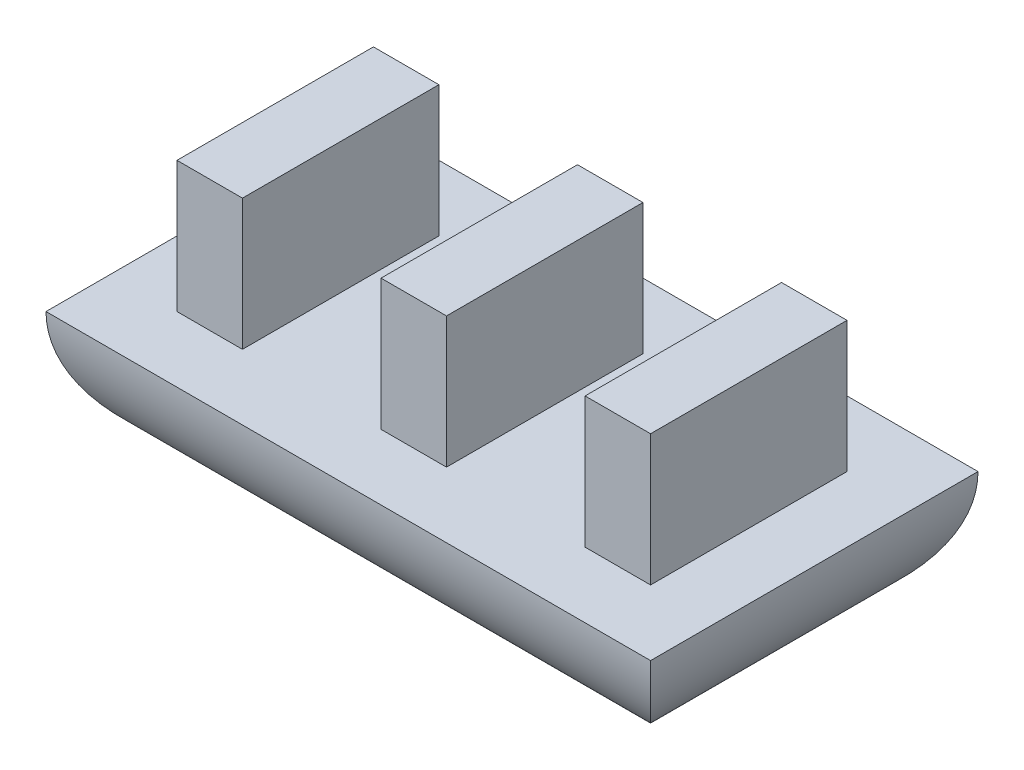
from build123d import *

# Parameters (mm, degrees)
SKETCH1_W           = 14.6558
SKETCH1_H           = 7.9375
SKETCH1_W_2         = 1.5875
SKETCH1_H_2         = 4.7625
BOSS_EXTRUDE1_DEPTH = 3.175
SKETCH1_3_W         = 1.5875
SKETCH1_3_H         = 4.7625
BOSS_EXTRUDE2_DEPTH = 3.175
FILLET1_R           = 3.175


with BuildPart() as part:
    # Sketch1 → Boss-Extrude1 (new body)
    # profile 1 of 4: a face of its own
    with BuildSketch(Plane(origin=(0, 0, 0), x_dir=(1, 0, 0), z_dir=(0, 1, 0))):
        with Locations((7.3279, 3.96875)):
            Rectangle(SKETCH1_W, SKETCH1_H)
        with Locations((12.27455, 3.96875)):
            Rectangle(SKETCH1_W_2, SKETCH1_H_2, mode=Mode.SUBTRACT)
        with Locations((7.3279, 3.96875)):
            Rectangle(SKETCH1_W_2, SKETCH1_H_2, mode=Mode.SUBTRACT)
        with Locations((2.38125, 3.96875)):
            Rectangle(SKETCH1_W_2, SKETCH1_H_2, mode=Mode.SUBTRACT)
    # profile 2 of 4: a face of its own
    with BuildSketch(Plane(origin=(0, 0, 0), x_dir=(1, 0, 0), z_dir=(0, 1, 0))):
        with Locations((2.38125, 3.96875)):
            Rectangle(SKETCH1_W_2, SKETCH1_H_2)
    # profile 3 of 4: a face of its own
    with BuildSketch(Plane(origin=(0, 0, 0), x_dir=(1, 0, 0), z_dir=(0, 1, 0))):
        with Locations((7.3279, 3.96875)):
            Rectangle(SKETCH1_W_2, SKETCH1_H_2)
    # profile 4 of 4: a face of its own
    with BuildSketch(Plane(origin=(0, 0, 0), x_dir=(1, 0, 0), z_dir=(0, 1, 0))):
        with Locations((12.27455, 3.96875)):
            Rectangle(SKETCH1_W_2, SKETCH1_H_2)
    extrude(amount=-BOSS_EXTRUDE1_DEPTH)

    # Sketch1<3> → Boss-Extrude2 (add)
    with BuildSketch(Plane(origin=(0, 0, 0), x_dir=(1, 0, 0), z_dir=(0, 1, 0))):
        with Locations((2.38125, 3.96875)):
            Rectangle(SKETCH1_3_W, SKETCH1_3_H)
        with Locations((7.3279, 3.96875)):
            Rectangle(SKETCH1_3_W, SKETCH1_3_H)
        with Locations((12.27455, 3.96875)):
            Rectangle(SKETCH1_3_W, SKETCH1_3_H)
    extrude(amount=BOSS_EXTRUDE2_DEPTH)

    # Fillet1
    fillet1_edges = [part.edges().sort_by_distance(p)[0] for p in [
        (14.6558, -3.175, -3.96875),
        (7.3279, -3.175, -7.9375),
        (0, -3.175, -3.96875),
        (7.3279, -3.175, 0),
    ]]
    fillet(fillet1_edges, radius=FILLET1_R - 0.0001)  # a hair under: the kernel refuses the full size


solid = part.part
